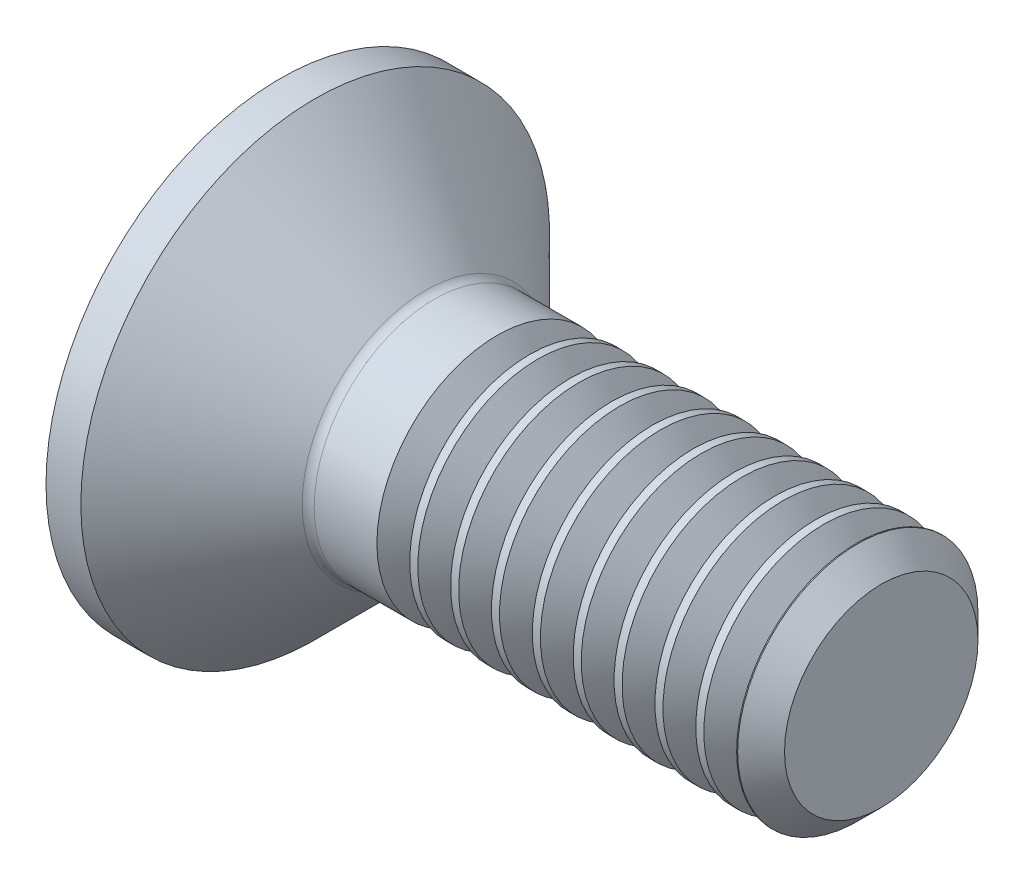
from build123d import *

# Parameters (mm, degrees)
FILLET1_R       = 0.2
HEX_START       = -1.5
HEX_2_DEPTH     = 1.5
THDSCHPAT_COUNT = 9
THDSCHPAT_PITCH = 0.68


with BuildPart() as part:
    # BodySke → BaseBody (revolve)
    with BuildSketch(Plane.XY, mode=Mode.PRIVATE) as basebody_sk:
        Polygon((0, 0), (0, 3.9), (0.58, 3.9), (2.48, 2), (9.61, 2), (10, 1.61), (10, 0), align=None)
    revolve(basebody_sk.sketch.rotate(Axis((0, 0, 0), (1, 0, 0)), 90), axis=Axis((0, 0, 0), (1, 0, 0)))

    # Fillet1
    fillet1_edges = [part.edges().sort_by_distance(p)[0] for p in [
        (2.48, 0, -2),
    ]]
    fillet(fillet1_edges, radius=FILLET1_R)

    # Hex 2: read off the stored shape, not the designer's step
    # Hex 2 outline → Hex 2 (cut)
    with BuildSketch(Plane.ZY.offset(HEX_START)):
        Polygon((-1.25, -0.721687836), (0, -1.443375673), (1.25, -0.721687836), (1.25, 0.721687836), (0, 1.443375673), (-1.25, 0.721687836), align=None)
    extrude(amount=HEX_2_DEPTH, mode=Mode.SUBTRACT)

    # Hex 2 2 outline → Hex 2 2 (revolve, cut)
    with BuildSketch(Plane.YX):
        Polygon((1.25, 1.5), (0, 2.221687836), (0, 1.5), align=None)
    revolve(axis=Axis((0, 0, 0), (1, 0, 0)), mode=Mode.SUBTRACT)

    # ThdSchSke → ThreadSchematic (revolve, cut)
    with BuildSketch(Plane.XY, mode=Mode.PRIVATE) as threadschematic_sk:
        Polygon((3.880001, -1.61), (3.60692006, -2), (3.60692006, -2.5), (4.15308194, -2.5), (4.15308194, -2), align=None)
    threadschematic = revolve(threadschematic_sk.sketch.rotate(Axis((-3.175, 0, 0), (1, 0, 0)), 270), axis=Axis((-3.175, 0, 0), (1, 0, 0)), mode=Mode.SUBTRACT)

    # ThdSchPat: ThreadSchematic ×9
    with Locations(*[(i * THDSCHPAT_PITCH, 0, 0) for i in range(1, THDSCHPAT_COUNT)]):
        add(threadschematic, mode=Mode.SUBTRACT)


solid = part.part
